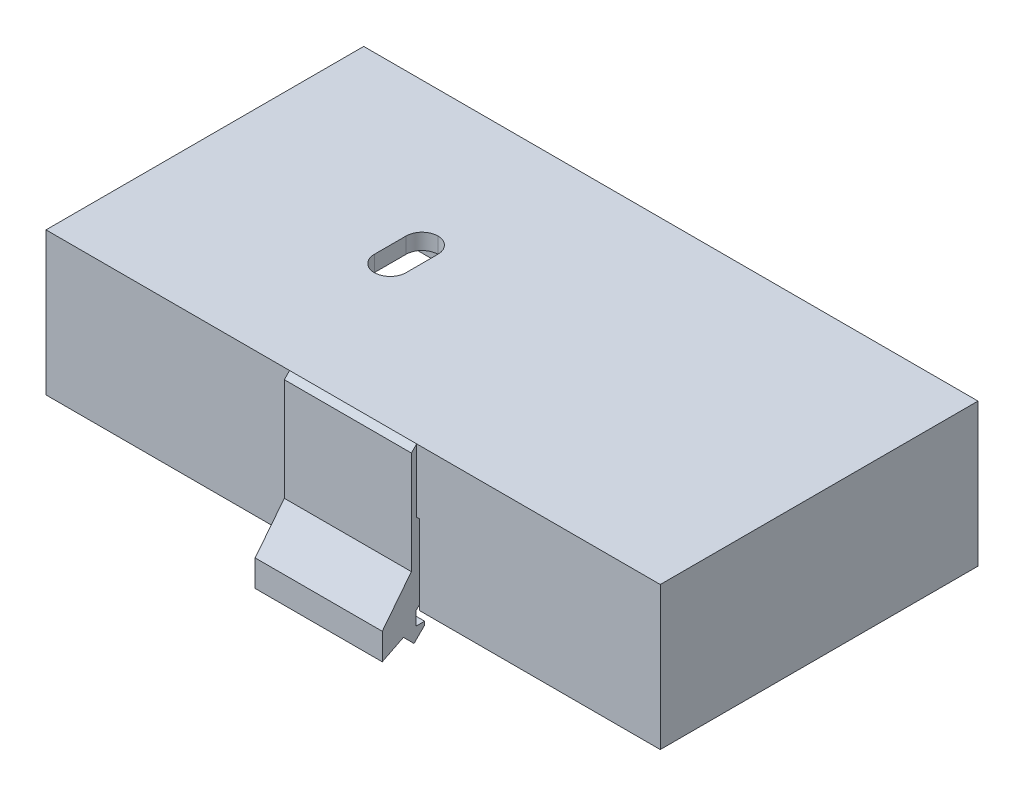
from build123d import *

# Parameters (mm, degrees)
SKETCH1_W           = 116
SKETCH1_H           = 60
SKETCH1_W_2         = 110
SKETCH1_H_2         = 54
BOSS_EXTRUDE1_DEPTH = 24
SKETCH2_W           = 116
SKETCH2_H           = 60
BOSS_EXTRUDE2_DEPTH = 3
CUT_EXTRUDE1_DEPTH  = 12.5
BOSS_EXTRUDE3_DEPTH = 12
SKETCH5_W           = 113.4
SKETCH5_H           = 57.4
SKETCH5_W_2         = 110
SKETCH5_H_2         = 54
CUT_EXTRUDE2_DEPTH  = 5.5
CUT_EXTRUDE3_REACH  = 77.802
SKETCH6_W           = 6
SKETCH6_H           = 12
FILLET3_R           = 3


with BuildPart() as part:
    # Sketch1 → Boss-Extrude1 (new body)
    with BuildSketch(Plane(origin=(0, 9.820251789, 0), x_dir=(1, 0, 0), z_dir=(0, 1, 0))):
        Rectangle(SKETCH1_W, SKETCH1_H)
        Rectangle(SKETCH1_W_2, SKETCH1_H_2, mode=Mode.SUBTRACT)
    extrude(amount=BOSS_EXTRUDE1_DEPTH)

    # Sketch2 → Boss-Extrude2 (add)
    with BuildSketch(Plane(origin=(0, 33.820251789, 0), x_dir=(1, 0, 0), z_dir=(0, 1, 0))):
        Rectangle(SKETCH2_W, SKETCH2_H)
    extrude(amount=BOSS_EXTRUDE2_DEPTH)

    # Sketch3 → Cut-Extrude1 (cut, symmetric)
    with BuildSketch(Plane(origin=(0, 0, 0), x_dir=(0, 0, -1), z_dir=(1, 0, 0))):
        Polygon((28.5, 9.820251789), (28.5, 23.320251789), (30, 24.820251789), (30, 9.820251789), align=None)
    cut_extrude1 = extrude(amount=CUT_EXTRUDE1_DEPTH, both=True, mode=Mode.SUBTRACT)

    # Sketch4 → Boss-Extrude3 (add, symmetric)
    with BuildSketch(Plane(origin=(0, 0, 0), x_dir=(0, 0, -1), z_dir=(1, 0, 0))):
        Polygon((30.1, 7.070251789), (28.5, 7.070251789), (28.5, 6.420251789), (30.5, 4.420251789), (32.5, 6.420251789), (36.5, 4.420251789), (36.5, 9.420251789), (31, 16.420251789), (31, 35.820251789), (30, 36.820251789), (29, 36.820251789), (29, 10.734465351), (30.1, 9.634465351), align=None)
    boss_extrude3 = extrude(amount=BOSS_EXTRUDE3_DEPTH, both=True)

    # Sketch5 → Cut-Extrude2 (cut)
    with BuildSketch(Plane.XZ.offset(-9.820251789)):
        Rectangle(SKETCH5_W, SKETCH5_H)
        Rectangle(SKETCH5_W_2, SKETCH5_H_2, mode=Mode.SUBTRACT)
    extrude(amount=-CUT_EXTRUDE2_DEPTH, mode=Mode.SUBTRACT)

    # Mirror1: Cut-Extrude1, Boss-Extrude3 across plane
    add(cut_extrude1.mirror(Plane.XY), mode=Mode.SUBTRACT)
    add(boss_extrude3.mirror(Plane.XY))

    # Sketch6 → Cut-Extrude3 (cut, up to next)
    with BuildSketch(Plane(origin=(0, 36.820251789, 0), x_dir=(1, 0, 0), z_dir=(0, 1, 0)), mode=Mode.PRIVATE) as cut_extrude3_sk1:
        with Locations((-20, 0)):
            Rectangle(SKETCH6_W, SKETCH6_H)
    cut_extrude3_tool1 = extrude(cut_extrude3_sk1.sketch, amount=-CUT_EXTRUDE3_REACH, mode=Mode.PRIVATE) & part.part
    add(cut_extrude3_tool1.solids().sort_by_distance((-20, 36.820252, 0))[0], mode=Mode.SUBTRACT)

    # Fillet3
    fillet3_edges = [part.edges().sort_by_distance(p)[0] for p in [
        (-23, 35.320251789, 6),
        (-17, 35.320251789, 6),
        (-17, 35.320251789, -6),
        (-23, 35.320251789, -6),
    ]]
    fillet(fillet3_edges, radius=FILLET3_R - 0.0001)  # a hair under: the kernel refuses the full size


solid = part.part
